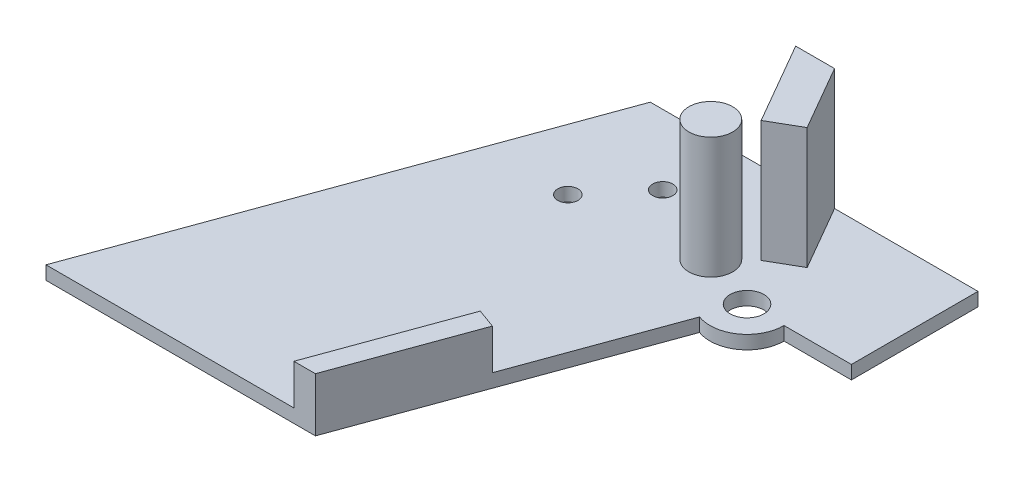
from build123d import *

# Parameters (mm, degrees)
BOSS_EXTRUDE1_DEPTH   = 20
SKETCH1_R             = 3.25
BOSS_EXTRUDE1_2_DEPTH = 20
BOSS_EXTRUDE3_DEPTH   = 8
SKETCH1_6_R           = 1.5
SKETCH1_6_R_2         = 2.5
SKETCH1_6_R_3         = 3.25
BOSS_EXTRUDE4_DEPTH   = 2


with BuildPart() as part:
    # Sketch1 → Boss-Extrude1 (new body)
    with BuildSketch(Plane(origin=(0, 0, 0), x_dir=(1, 0, 0), z_dir=(0, 1, 0))):
        Polygon((51.302008157, 65.778483455), (45.528505465, 65.778483455), (52.528505465, 53.654127802), (56.858632484, 56.154127802), align=None)
    extrude(amount=BOSS_EXTRUDE1_DEPTH)



with BuildPart() as body_2:
    # Sketch1 → Boss-Extrude1 2 (new body)
    with BuildSketch(Plane(origin=(0, 0, 0), x_dir=(1, 0, 0), z_dir=(0, 1, 0))):
        with Locations((48.643773579, 50.062812329)):
            Circle(SKETCH1_R)
    extrude(amount=BOSS_EXTRUDE1_2_DEPTH)


with BuildPart() as body_3:
    # Sketch1<5> → Boss-Extrude3 (new body)
    with BuildSketch(Plane(origin=(0, 0, 0), x_dir=(1, 0, 0), z_dir=(0, 1, 0))):
        Polygon((44.192335076, 20.289759156), (36.807466683, 0), (40, 0), (47.011412938, 19.263698726), align=None)
    extrude(amount=BOSS_EXTRUDE3_DEPTH)


with BuildPart() as part_1:
    add(part.part)

    add(body_2.part)  # Boss-Extrude4 merges body 2

    add(body_3.part)  # Boss-Extrude4 merges body 3
    # Sketch1<6> → Boss-Extrude4 (add)
    with BuildSketch(Plane(origin=(0, 0, 0), x_dir=(1, 0, 0), z_dir=(0, 1, 0))):
        with BuildLine():
            Line((23.941410033, 65.778483455), (0, 0))
            Line((0, 0), (36.807466683, 0))
            Line((36.807466683, 0), (44.192335076, 20.289759156))
            Line((44.192335076, 20.289759156), (47.011412938, 19.263698726))
            Line((47.011412938, 19.263698726), (55.219896378, 41.816321625))
            ThreePointArc((55.219896378, 41.816321625), (60.255677566, 42.479294796), (62.601007166, 46.984631039))
            Line((62.601007166, 46.984631039), (72.601007166, 46.984631039))
            Line((72.601007166, 46.984631039), (72.601007166, 65.778483455))
            Line((72.601007166, 65.778483455), (51.302008157, 65.778483455))
            Line((51.302008157, 65.778483455), (56.858632484, 56.154127802))
            Line((56.858632484, 56.154127802), (52.528505465, 53.654127802))
            Line((52.528505465, 53.654127802), (45.528505465, 65.778483455))
            Line((45.528505465, 65.778483455), (23.941410033, 65.778483455))
        make_face()
        with Locations((29.71541075, 47.764679)):
            Circle(SKETCH1_6_R, mode=Mode.SUBTRACT)
        with Locations((36.143286847, 55.425123431)):
            Circle(SKETCH1_6_R, mode=Mode.SUBTRACT)
        with Locations((57.101007166, 46.984631039)):
            Circle(SKETCH1_6_R_2, mode=Mode.SUBTRACT)
        with Locations((48.643773579, 50.062812329)):
            Circle(SKETCH1_6_R_3, mode=Mode.SUBTRACT)
    extrude(amount=BOSS_EXTRUDE4_DEPTH)


solid = part_1.part
